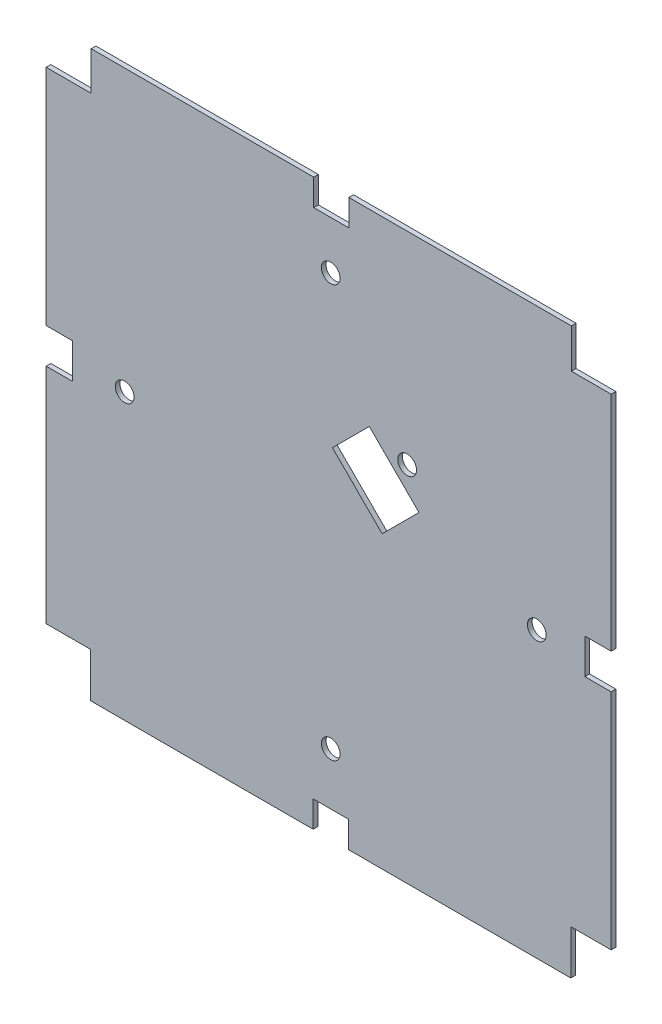
from build123d import *

# Parameters (mm, degrees)
SKETCH1_R           = 1.6
BOSS_EXTRUDE1_DEPTH = 0.8
CUT_EXTRUDE1_DEPTH  = 0.8


with BuildPart() as part:
    # Sketch1 → Boss-Extrude1 (new body)
    with BuildSketch(Plane.XY):
        Polygon((-21.328326925, 35.64702685), (-59.328326925, 35.64702685), (-59.328326925, 29.04702685), (-67.028326925, 29.04702685), (-67.028326925, -9.15297315), (-62.528326925, -9.15297315), (-62.528326925, -15.15297315), (-67.028326925, -15.15297315), (-67.028326925, -53.25297315), (-59.428326925, -53.25297315), (-59.428326925, -60.85297315), (-21.428326925, -60.85297315), (-21.428326925, -56.35297315), (-15.428326925, -56.35297315), (-15.428326925, -60.85297315), (22.571673075, -60.85297315), (22.571673075, -53.25297315), (29.471673075, -53.25297315), (29.471673075, -15.073036827), (24.971673075, -15.073036827), (24.971673075, -9.073036827), (29.471673075, -9.073036827), (29.471673075, 28.94702685), (22.671673075, 28.94702685), (22.671673075, 35.64702685), (-15.328326925, 35.64702685), (-15.328326925, 31.14702685), (-21.328326925, 31.14702685), align=None)
        with Locations((-18.428147066, -47.449600232)):
            Circle(SKETCH1_R, mode=Mode.SUBTRACT)
        with Locations((-53.624954006, -12.252793292)):
            Circle(SKETCH1_R, mode=Mode.SUBTRACT)
        with Locations((-5.370945752, 1.09702685)):
            Circle(SKETCH1_R, mode=Mode.SUBTRACT)
        with Locations((16.768659873, -12.252793292)):
            Circle(SKETCH1_R, mode=Mode.SUBTRACT)
        with Locations((-18.428147066, 22.944013647)):
            Circle(SKETCH1_R, mode=Mode.SUBTRACT)
    extrude(amount=BOSS_EXTRUDE1_DEPTH)

    # Sketch2 → Cut-Extrude1 (cut)
    with BuildSketch(Plane.XY.offset(0.8)):
        Polygon((-3.35240311, -4.96233071), (-11.837684484, 3.522950664), (-18.130934836, -2.770299688), (-9.645653462, -11.255581062), align=None)
    extrude(amount=-CUT_EXTRUDE1_DEPTH, mode=Mode.SUBTRACT)


solid = part.part
